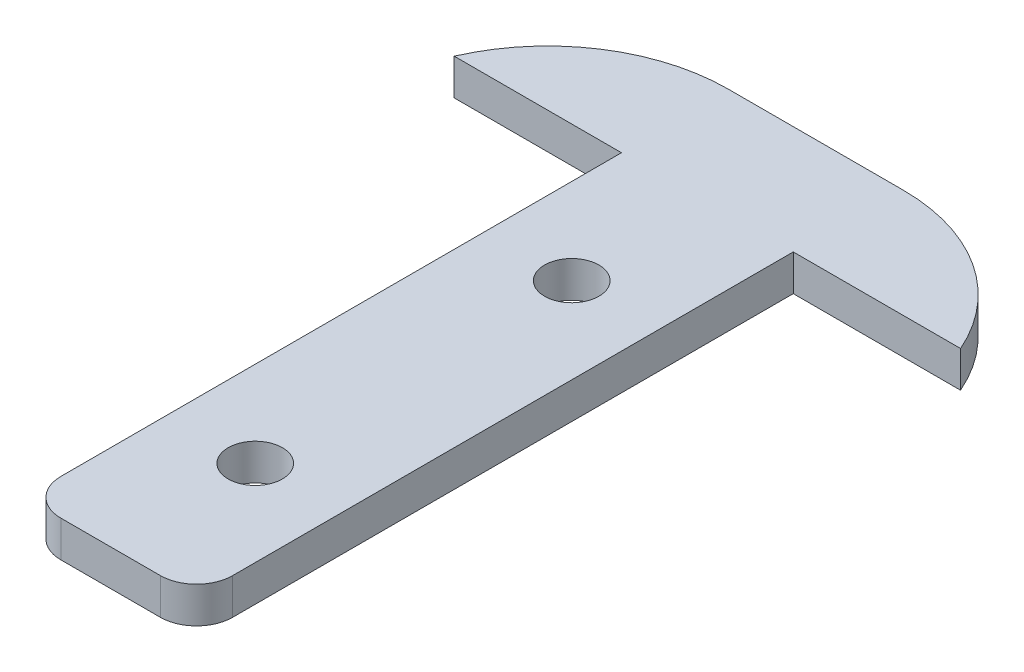
from build123d import *

# Parameters (mm, degrees)
SKETCH1_W           = 9.5
SKETCH1_H           = 33
SKETCH1_W_2         = 28
SKETCH1_H_2         = 6
BOSS_EXTRUDE2_DEPTH = 2
SKETCH2_R           = 1.5
CUT_EXTRUDE1_DEPTH  = 27.575364532
FILLET6_R           = 10
FILLET7_R           = 10
FILLET10_R          = 2


with BuildPart() as part:
    # Sketch1 → Boss-Extrude2 (new body)
    with BuildSketch(Plane(origin=(0, 0, 0), x_dir=(1, 0, 0), z_dir=(0, 1, 0))):
        Rectangle(SKETCH1_W, SKETCH1_H)
        with Locations((0, 19.5)):
            Rectangle(SKETCH1_W_2, SKETCH1_H_2)
    extrude(amount=BOSS_EXTRUDE2_DEPTH)

    # Sketch2 → Cut-Extrude1 (cut, through all)
    with BuildSketch(Plane.XZ):
        with Locations(Location((0, 8.5, 0), (0, 0, 270))):
            Circle(SKETCH2_R)
        with Locations(Location((0, -9, 0), (0, 0, 270))):
            Circle(SKETCH2_R)
    extrude(amount=-CUT_EXTRUDE1_DEPTH, mode=Mode.SUBTRACT)

    # Fillet6
    # the kernel refuses this fillet: 10 mm, written as the material it takes off along each edge
    with BuildSketch(Plane(origin=(14, -22.912878475, -22.5), x_dir=(-1, 0, 0), z_dir=(0, 1, 0))) as fillet6_piece_1:
        with BuildLine():
            CenterArc((9.16515139, 10), FILLET6_R, 203.578178478, 66.421821522)
            Line((0, 6), (-0.183303028, 5.92))
            ThreePointArc((-0.183303028, 5.92), (-0.2, 3), (-0.2, 0))
            Line((-0.2, 0), (0, -0.2))
            Line((0, -0.2), (9.16515139, -0.2))
            Line((9.16515139, -0.2), (9.16515139, 0))
        make_face()
    extrude(amount=47.82575695, mode=Mode.SUBTRACT)

    # Fillet7
    # the kernel refuses this fillet: 10 mm, written as the material it takes off along each edge
    with BuildSketch(Plane(origin=(-14, -22.912878475, -22.5), x_dir=(0, 0, 1), z_dir=(0, 1, 0))) as fillet7_piece_1:
        with BuildLine():
            CenterArc((10, 9.16515139), FILLET7_R, 180, 66.421821522)
            Line((0, 9.16515139), (-0.2, 9.16515139))
            Line((-0.2, 9.16515139), (-0.2, 0))
            Line((-0.2, 0), (0, -0.2))
            ThreePointArc((0, -0.2), (3, -0.2), (5.92, -0.183303028))
            Line((5.92, -0.183303028), (6, 0))
        make_face()
    extrude(amount=47.82575695, mode=Mode.SUBTRACT)

    # Fillet10
    fillet10_edges = [part.edges().sort_by_distance(p)[0] for p in [
        (4.75, 1, 16.5),
        (-4.75, 1, 16.5),
    ]]
    fillet(fillet10_edges, radius=FILLET10_R)


solid = part.part
